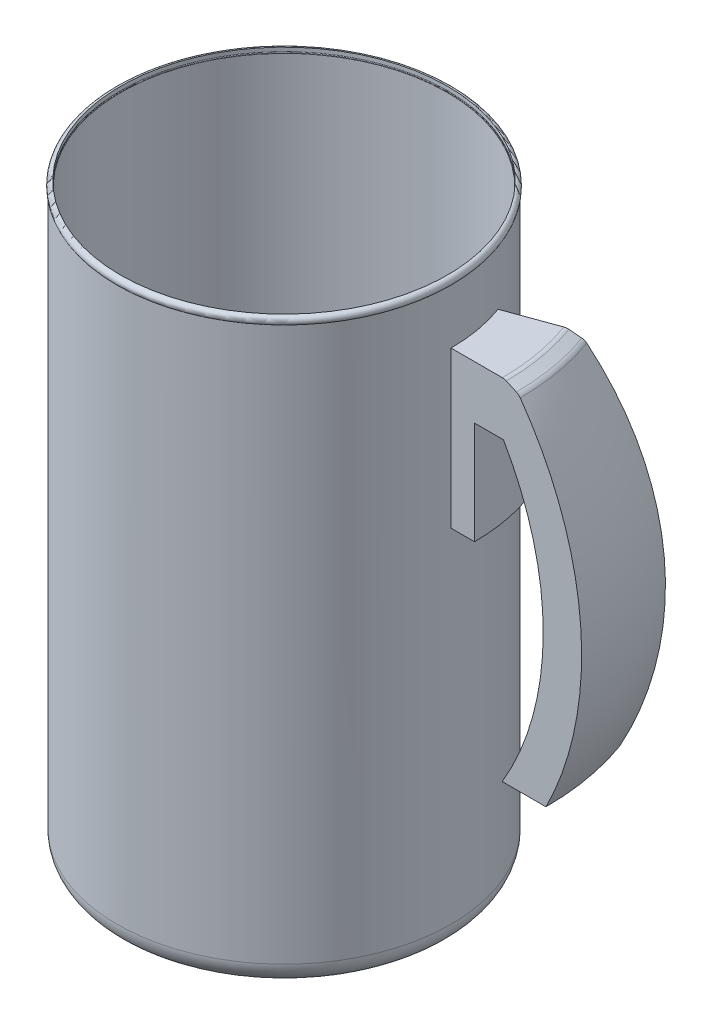
from build123d import *

# Parameters (mm, degrees)
REVOLVE2_ANGLE = 20


with BuildPart() as part:
    # Sketch1 → Revolve1 (revolve)
    with BuildSketch(Plane.XY, mode=Mode.PRIVATE) as revolve1_sk:
        with BuildLine():
            Line((0, 15.190892732), (-75, 15.190892732))
            ThreePointArc((-75, 15.190892732), (-82.071067812, 18.11982492), (-85, 25.190892732))
            Line((-85, 25.190892732), (-85, 314.480751979))
            ThreePointArc((-85, 314.480751979), (-85.048474494, 314.597779759), (-85.165502274, 314.646254252))
            Line((-85.165502274, 314.646254252), (-85.184354085, 314.646254252))
            ThreePointArc((-85.184354085, 314.646254252), (-85.456673325, 314.918573492), (-85.184354085, 315.190892732))
            Line((-85.184354085, 315.190892732), (0, 315.190892732))
            Line((0, 315.190892732), (0, 15.190892732))
        make_face()
    revolve(revolve1_sk.sketch.rotate(Axis((0, 15.190892732, 0), (0, 1, 0)), 270), axis=Axis((0, 15.190892732, 0), (0, 1, 0)))

    # Shell7: read off the stored shape, not the designer's step
    # Shell7 outline → Shell7 (revolve, cut)
    with BuildSketch(Plane.XY):
        with BuildLine():
            Line((85.184354085, 18.844324221), (85.184354085, 315.190892732))
            Line((85.184354085, 315.190892732), (0, 315.190892732))
            Line((0, 315.190892732), (0, 13.190892732))
            Line((0, 13.190892732), (75, 13.190892732))
            ThreePointArc((75, 13.190892732), (80.824138471, 14.699019159), (85.184354085, 18.844324221))
        make_face()
    revolve(axis=Axis((0, 0, 0), (0, 1, 0)), mode=Mode.SUBTRACT)

    # Shell7 2 outline → Shell7 2 (revolve)
    with BuildSketch(Plane.XY):
        with BuildLine():
            Line((85.184354085, 317.190892732), (85.184354085, 18.844324221))
            ThreePointArc((85.184354085, 18.844324221), (86.537162758, 21.890305589), (87, 25.190892732))
            Line((87, 25.190892732), (87, 313.552240941))
            ThreePointArc((87, 313.552240941), (87.21760007, 315.933140145), (85.184354085, 317.190892732))
        make_face()
    revolve(axis=Axis((0, 0, 0), (0, 1, 0)))

    # Shell7 3 outline → Shell7 3 (revolve, cut)
    with BuildSketch(Plane.XY):
        with BuildLine():
            Line((85.184354085, 315.190892732), (85.184354085, 314.646254252))
            ThreePointArc((85.184354085, 314.646254252), (85.456673325, 314.918573492), (85.184354085, 315.190892732))
        make_face()
    revolve(axis=Axis((0, 0, 0), (0, 1, 0)), mode=Mode.SUBTRACT)

    # Shell7 4 outline → Shell7 4 (revolve)
    with BuildSketch(Plane.XY):
        with BuildLine():
            Line((85.184354085, 18.844324221), (85.184354085, 314.646254252))
            Line((85.184354085, 314.646254252), (85.165502274, 314.646254252))
            ThreePointArc((85.165502274, 314.646254252), (85.048474494, 314.597779759), (85, 314.480751979))
            Line((85, 314.480751979), (85, 25.190892732))
            ThreePointArc((85, 25.190892732), (82.071067812, 18.11982492), (75, 15.190892732))
            Line((75, 15.190892732), (0, 15.190892732))
            Line((0, 15.190892732), (0, 13.190892732))
            Line((0, 13.190892732), (75, 13.190892732))
            ThreePointArc((75, 13.190892732), (80.824138471, 14.699019159), (85.184354085, 18.844324221))
        make_face()
    revolve(axis=Axis((0, 0, 0), (0, 1, 0)))

    # Sketch4 → Revolve2 (revolve)
    with BuildSketch(Plane.XY):
        with BuildLine():
            Line((87, 285.165847721), (113.741198075, 285.165847721))
            ThreePointArc((113.741198075, 285.165847721), (114.79047458, 285.054509994), (115.793021461, 284.725455247))
            Line((115.793021461, 284.725455247), (121.036139762, 282.366052012))
            ThreePointArc((121.036139762, 282.366052012), (122.156610921, 281.671227445), (123.056514115, 280.707686559))
            ThreePointArc((123.056514115, 280.707686559), (154.540912997, 193.685812088), (136.46168064, 102.926705841))
            Line((136.46168064, 102.926705841), (113.655526061, 102.926705841))
            ThreePointArc((113.655526061, 102.926705841), (135.027338912, 180.099482709), (114.295923717, 257.446753496))
            Line((114.295923717, 257.446753496), (99.227934217, 257.446753496))
            Line((99.227934217, 257.446753496), (99.227934217, 203.913989012))
            Line((99.227934217, 203.913989012), (87, 203.913989012))
            Line((87, 203.913989012), (87, 285.165847721))
        make_face()
    revolve(axis=Axis((0, 0, 0), (0, 1, 0)), revolution_arc=REVOLVE2_ANGLE)


solid = part.part
